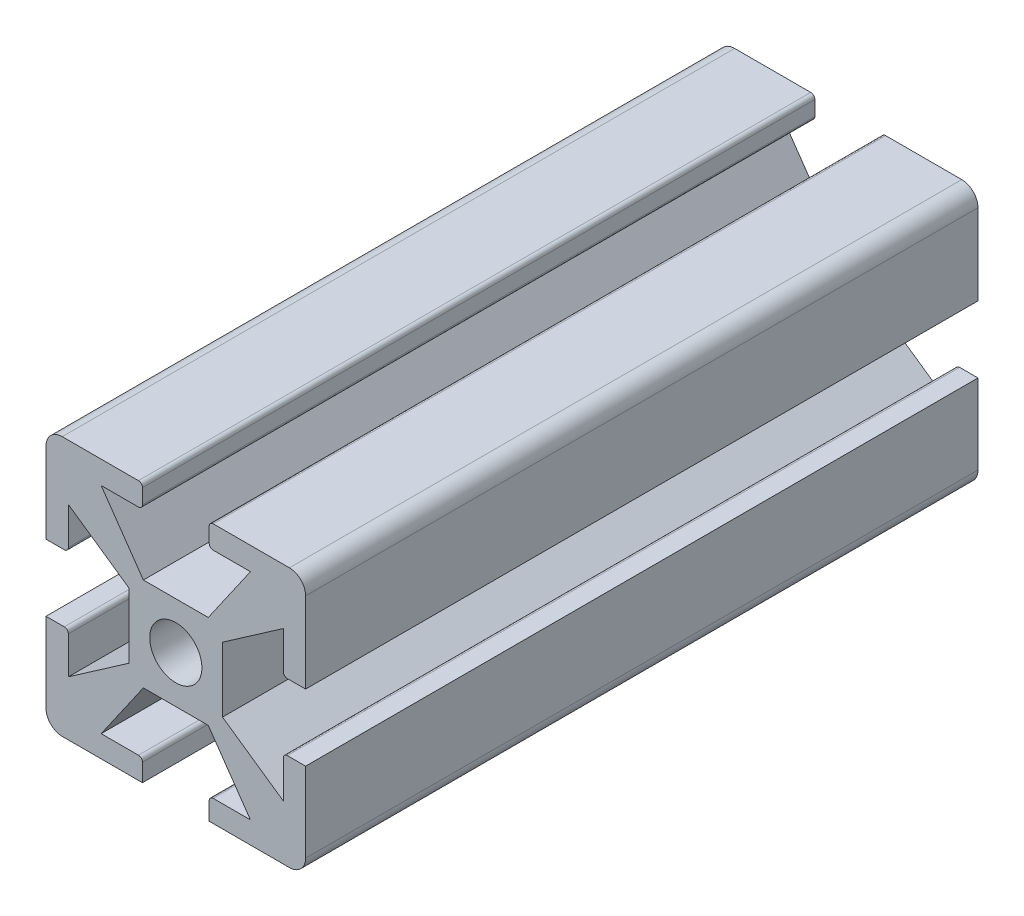
from build123d import *

# Parameters (mm, degrees)
SKETCH1_W                   = 25.4
SKETCH1_H                   = 25.4
BOSS_EXTRUDE1_DEPTH         = 65.786
FILLET1_R                   = 1.5875
HOLE1_OUTLINE_R             = 2.5527
HOLE1_DEPTH                 = 65.786
SKETCH7_W                   = 6.5278
SKETCH7_H                   = 2.2352
CUT_EXTRUDE2_DEPTH          = 65.786
FILLET4_R                   = 0.396875
CIRPATTERN2_DEPTH           = 65.786
F_1_4_20_TAPPED_HOLE1_D     = 5.1054
F_1_4_20_TAPPED_HOLE1_DEPTH = 6.35
F_1_4_20_TAPPED_HOLE1_TIP   = 1.533816902


# Read off the part's stored shape, not the designer's step: Hole1, CirPattern2
with BuildPart() as part:
    # Sketch1 → Boss-Extrude1 (new body)
    with BuildSketch(Plane.XY):
        Rectangle(SKETCH1_W, SKETCH1_H)
    extrude(amount=BOSS_EXTRUDE1_DEPTH)

    # Fillet1
    fillet1_edges = [part.edges().sort_by_distance(p)[0] for p in [
        (12.7, -12.7, 32.893),
        (-12.7, -12.7, 32.893),
        (-12.7, 12.7, 32.893),
        (12.7, 12.7, 32.893),
    ]]
    fillet(fillet1_edges, radius=FILLET1_R)

    # Hole1 outline → Hole1 (cut)
    with BuildSketch(Plane.XY):
        with Locations((0, -0.048792482)):
            Circle(HOLE1_OUTLINE_R)
    extrude(amount=HOLE1_DEPTH, mode=Mode.SUBTRACT)

    # Sketch7 → Cut-Extrude2 (cut)
    with BuildSketch(Plane.XY.offset(65.786)):
        with Locations((0, 11.5824)):
            Rectangle(SKETCH7_W, SKETCH7_H)
        Polygon((-3.175, 4.5212), (-7.3025, 10.4648), (7.3025, 10.4648), (3.175, 4.5212), align=None)
    extrude(amount=-CUT_EXTRUDE2_DEPTH, mode=Mode.SUBTRACT)

    # Fillet4
    fillet4_edges = [part.edges().sort_by_distance(p)[0] for p in [
        (-3.2639, 10.4648, 32.893),
        (-3.2639, 12.7, 32.893),
        (3.2639, 12.7, 32.893),
        (3.2639, 10.4648, 32.893),
    ]]
    fillet(fillet4_edges, radius=FILLET4_R)

    # CirPattern2 outline → CirPattern2 (cut)
    with BuildSketch(Plane.XY):
        with BuildLine():
            ThreePointArc((-3.660775, -10.562384964), (-3.380141996, -10.67862696), (-3.2639, -10.959259964))
            Line((-3.2639, -10.959259964), (-3.2639, -12.7))
            Line((-3.2639, -12.7), (3.2639, -12.7))
            Line((3.2639, -12.7), (3.2639, -10.959259964))
            ThreePointArc((3.2639, -10.959259964), (3.380141996, -10.67862696), (3.660775, -10.562384964))
            Line((3.660775, -10.562384964), (7.3025, -10.562384964))
            Line((7.3025, -10.562384964), (3.175, -4.618784964))
            Line((3.175, -4.618784964), (-3.175, -4.618784964))
            Line((-3.175, -4.618784964), (-7.3025, -10.562384964))
            Line((-7.3025, -10.562384964), (-3.660775, -10.562384964))
        make_face()
        with BuildLine():
            Line((-12.7, -3.312692482), (-10.910467482, -3.312692482))
            ThreePointArc((-10.910467482, -3.312692482), (-10.629834478, -3.428934478), (-10.513592482, -3.709567482))
            Line((-10.513592482, -3.709567482), (-10.513592482, -7.351292482))
            Line((-10.513592482, -7.351292482), (-4.569992482, -3.223792482))
            Line((-4.569992482, -3.223792482), (-4.569992482, 3.126207518))
            Line((-4.569992482, 3.126207518), (-10.513592482, 7.253707518))
            Line((-10.513592482, 7.253707518), (-10.513592482, 3.611982518))
            ThreePointArc((-10.513592482, 3.611982518), (-10.629834478, 3.331349514), (-10.910467482, 3.215107518))
            Line((-10.910467482, 3.215107518), (-12.7, 3.215107518))
            Line((-12.7, 3.215107518), (-12.7, -3.312692482))
        make_face()
        with BuildLine():
            ThreePointArc((10.513592482, -3.709567482), (10.629834478, -3.428934478), (10.910467482, -3.312692482))
            Line((10.910467482, -3.312692482), (12.7, -3.312692482))
            Line((12.7, -3.312692482), (12.7, 3.215107518))
            Line((12.7, 3.215107518), (10.910467482, 3.215107518))
            ThreePointArc((10.910467482, 3.215107518), (10.629834478, 3.331349514), (10.513592482, 3.611982518))
            Line((10.513592482, 3.611982518), (10.513592482, 7.253707518))
            Line((10.513592482, 7.253707518), (4.569992482, 3.126207518))
            Line((4.569992482, 3.126207518), (4.569992482, -3.223792482))
            Line((4.569992482, -3.223792482), (10.513592482, -7.351292482))
            Line((10.513592482, -7.351292482), (10.513592482, -3.709567482))
        make_face()
    extrude(amount=CIRPATTERN2_DEPTH, mode=Mode.SUBTRACT)

    # 1/4-20 Tapped Hole1
    with Locations(Plane(origin=(0, -0.048792482, 65.786), x_dir=(1, 0, 0), z_dir=(0, 0, 1))):
        with Locations((0, 0)):
            Hole(F_1_4_20_TAPPED_HOLE1_D / 2, depth=F_1_4_20_TAPPED_HOLE1_DEPTH)
            with Locations((0, 0, -(F_1_4_20_TAPPED_HOLE1_DEPTH + F_1_4_20_TAPPED_HOLE1_TIP / 2))):  # 118° drill point
                Cone(0, F_1_4_20_TAPPED_HOLE1_D / 2, F_1_4_20_TAPPED_HOLE1_TIP, mode=Mode.SUBTRACT)


solid = part.part
